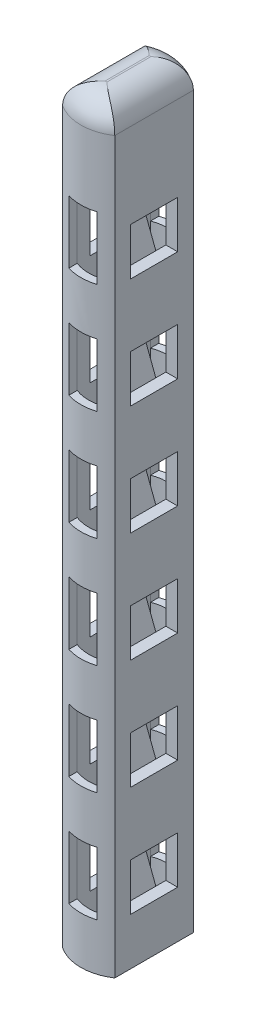
from build123d import *

# Parameters (mm, degrees)
BOSS_EXTRUDE1_DEPTH = 90
WRAP1_START         = -6.633249581
WRAP1_OUTLINE_W     = 6
WRAP1_OUTLINE_H     = 6
WRAP1_DEPTH         = 6.633249581
SKETCH4_W           = 3.6
SKETCH4_H           = 8
CUT_EXTRUDE1_DEPTH  = 5
CIRPATTERN3_COUNT   = 2
BOSS_EXTRUDE2_DEPTH = 2
LPATTERN1_COUNT     = 6
LPATTERN1_PITCH     = 14
BOSS_EXTRUDE3_DEPTH = 6
FILLET4_R           = 3.2


# Read off the part's stored shape, not the designer's step: Wrap1
with BuildPart() as part:
    # Sketch1 → Boss-Extrude1 (new body)
    with BuildSketch(Plane(origin=(0, 0, 0), x_dir=(1, 0, 0), z_dir=(0, 1, 0))):
        with BuildLine():
            Line((-3.31662479, 5), (-3.31662479, -5))
            ThreePointArc((-3.31662479, -5), (0, -6), (3.31662479, -5))
            Line((3.31662479, -5), (3.31662479, 5))
            ThreePointArc((3.31662479, 5), (0, 6), (-3.31662479, 5))
        make_face()
        with BuildLine():
            Line((-1.81662479, -4.658312395), (-1.81662479, 4.658312395))
            ThreePointArc((-1.81662479, 4.658312395), (0, 5), (1.81662479, 4.658312395))
            Line((1.81662479, 4.658312395), (1.81662479, -4.658312395))
            ThreePointArc((1.81662479, -4.658312395), (0, -5), (-1.81662479, -4.658312395))
        make_face(mode=Mode.SUBTRACT)
    extrude(amount=BOSS_EXTRUDE1_DEPTH)

    # Wrap1 outline → Wrap1 (cut)
    with BuildSketch(Plane(origin=(3.31662479, 0, 0), x_dir=(0, 0, -1), z_dir=(1, 0, 0)).offset(WRAP1_START)):
        with Locations((0, 79)):
            Rectangle(WRAP1_OUTLINE_W, WRAP1_OUTLINE_H)
        with Locations((0, 65)):
            Rectangle(WRAP1_OUTLINE_W, WRAP1_OUTLINE_H)
        with Locations((0, 51)):
            Rectangle(WRAP1_OUTLINE_W, WRAP1_OUTLINE_H)
        with Locations((0, 37)):
            Rectangle(WRAP1_OUTLINE_W, WRAP1_OUTLINE_H)
        with Locations((0, 23)):
            Rectangle(WRAP1_OUTLINE_W, WRAP1_OUTLINE_H)
        with Locations((0, 9)):
            Rectangle(WRAP1_OUTLINE_W, WRAP1_OUTLINE_H)
    extrude(amount=WRAP1_DEPTH, mode=Mode.SUBTRACT)

    # Sketch4 → Cut-Extrude1 (cut)
    with BuildSketch(Plane.XY.offset(6)):
        with Locations((0, 10)):
            Rectangle(SKETCH4_W, SKETCH4_H)
        with Locations((0, 24)):
            Rectangle(SKETCH4_W, SKETCH4_H)
        with Locations((0, 38)):
            Rectangle(SKETCH4_W, SKETCH4_H)
        with Locations((0, 52)):
            Rectangle(SKETCH4_W, SKETCH4_H)
        with Locations((0, 66)):
            Rectangle(SKETCH4_W, SKETCH4_H)
        with Locations((0, 80)):
            Rectangle(SKETCH4_W, SKETCH4_H)
    cut_extrude1 = extrude(amount=-CUT_EXTRUDE1_DEPTH, mode=Mode.SUBTRACT)

    # CirPattern3: Cut-Extrude1 ×2 about axis
    cirpattern3_axis = Axis((0, 90, 0), (0, -1, 0))
    for i in range(1, CIRPATTERN3_COUNT):
        add(cut_extrude1.rotate(cirpattern3_axis, i * 360 / CIRPATTERN3_COUNT), mode=Mode.SUBTRACT)

    # Sketch5 → Boss-Extrude2 (add)
    with BuildSketch(Plane.XZ):
        with BuildLine():
            Line((1.81662479, 4.658312395), (1.81662479, -4.658312395))
            ThreePointArc((1.81662479, -4.658312395), (0, -5), (-1.81662479, -4.658312395))
            Line((-1.81662479, -4.658312395), (-1.81662479, 4.658312395))
            ThreePointArc((-1.81662479, 4.658312395), (0, 5), (1.81662479, 4.658312395))
        make_face()
    extrude(amount=-BOSS_EXTRUDE2_DEPTH)

    # Sketch8 → Loft1 section 0
    with BuildSketch(Plane.ZY.offset(-1.81662479)):
        with BuildLine():
            Line((-2, 75), (2, 75))
            Line((2, 75), (2, 73.5))
            Line((2, 73.5), (-2, 73.5))
            Line((-2, 73.5), (-2, 75))
        make_face()
    # Sketch6 → Loft1 section 1
    with BuildSketch(Plane(origin=(-1.81662479, 0, 0), x_dir=(0, 0, -1), z_dir=(1, 0, 0))):
        with BuildLine():
            Line((-2, 84.5), (2, 84.5))
            Line((2, 84.5), (2, 83))
            Line((2, 83), (-2, 83))
            Line((-2, 83), (-2, 84.5))
        make_face()
    loft1 = loft()

    # LPattern1: Loft1 ×6
    with Locations(*[(0, -i * LPATTERN1_PITCH, 0) for i in range(1, LPATTERN1_COUNT)]):
        add(loft1)

    # Sketch10 → Boss-Extrude3 (add)
    with BuildSketch(Plane(origin=(0, 90, 0), x_dir=(1, 0, 0), z_dir=(0, 1, 0))):
        with BuildLine():
            Line((-3.31662479, 5), (-3.31662479, -5))
            ThreePointArc((-3.31662479, -5), (0, -6), (3.31662479, -5))
            Line((3.31662479, -5), (3.31662479, 5))
            ThreePointArc((3.31662479, 5), (0, 6), (-3.31662479, 5))
        make_face()
    extrude(amount=BOSS_EXTRUDE3_DEPTH)

    # Fillet4
    # the kernel refuses this fillet: 3.2 mm, written as the material it takes off along each edge
    with BuildSketch(Plane(origin=(0, 96, 0), x_dir=(0.9398790484692316, 0, 0.34150750247772244), z_dir=(-0.34150750247772244, 0, 0.9398790484692316))) as fillet4_piece_1:
        with BuildLine():
            CenterArc((6 - FILLET4_R, -FILLET4_R), FILLET4_R, 0, 90)
            Line((6, -FILLET4_R), (6, 0))
            Line((6, 0), (6 - FILLET4_R, 0))
        make_face()
    revolve(axis=Axis((0, 96, 0), (0, 1, 0)), revolution_arc=219.937491809, mode=Mode.SUBTRACT)
    with BuildSketch(Plane(origin=(-3.31662479, 96, -13), x_dir=(0, -1, 0), z_dir=(0, 0, 1)), Plane(origin=(3.31662479, 96, 13), x_dir=(0, -1, 0), z_dir=(0, 0, -1))) as fillet4_piece_2:
        with BuildLine():
            CenterArc((FILLET4_R, FILLET4_R), FILLET4_R, 180, 90)
            Line((0, FILLET4_R), (0, 0))
            Line((0, 0), (FILLET4_R, 0))
        make_face()
    extrude(amount=26, mode=Mode.SUBTRACT)
    with BuildSketch(Plane(origin=(0, 96, 0), x_dir=(-0.9398790484692316, 0, -0.34150750247772244), z_dir=(0.34150750247772244, 0, -0.9398790484692316))) as fillet4_piece_3:
        with BuildLine():
            CenterArc((6 - FILLET4_R, -FILLET4_R), FILLET4_R, 0, 90)
            Line((6 - FILLET4_R, 0), (6, 0))
            Line((6, 0), (6, -FILLET4_R))
        make_face()
    revolve(axis=Axis((0, 96, 0), (0, 1, 0)), revolution_arc=219.937491809, mode=Mode.SUBTRACT)


solid = part.part
